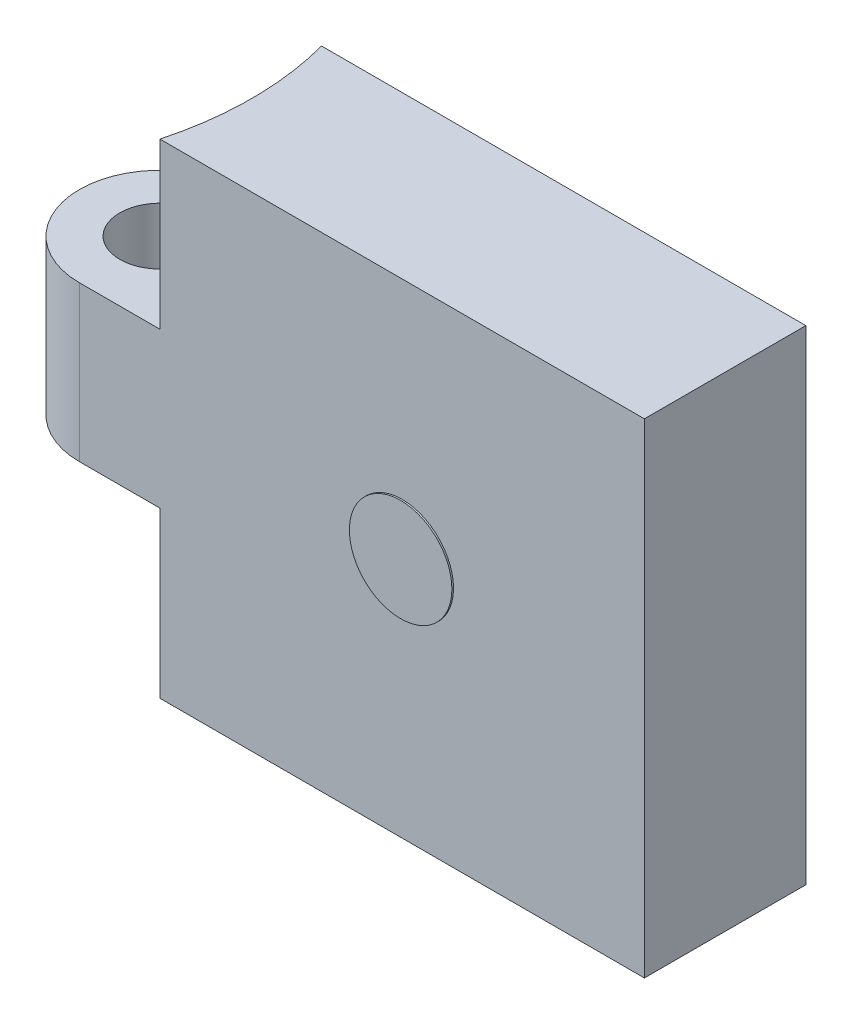
from build123d import *

# Parameters (mm, degrees)
RESSALTO_EXTRUS_O1_DEPTH = 10
ESBO_O2_R                = 2.5
CORTE_EXTRUS_O1_DEPTH    = 10
FILETE1_R                = 5
CORTE_EXTRUS_O4_DEPTH    = 10
CORTE_EXTRUS_O5_DEPTH    = 10
ESBO_O7_R                = 3.175
RESSALTO_EXTRUS_O2_DEPTH = 0.1


with BuildPart() as part:
    # Esboço1 → Ressalto-extrusão1 (new body)
    with BuildSketch(Plane.XY):
        Polygon((-10, -7.5), (20, 15), (-10, 15), (-10, 4.8), (-20, 4.8), (-20, -4.8), (-10, -4.8), align=None)
        Polygon((20, -15), (20, 15), (-10, -7.5), (-10, -15), align=None)
    extrude(amount=RESSALTO_EXTRUS_O1_DEPTH)

    # Esboço2 → Corte-extrusão1 (cut)
    with BuildSketch(Plane.XZ.offset(4.8)):
        with Locations(Location((-15, 5, 0), (0, 0, 270))):
            Circle(ESBO_O2_R)
    extrude(amount=-CORTE_EXTRUS_O1_DEPTH, mode=Mode.SUBTRACT)

    # Filete1
    filete1_edges = [part.edges().sort_by_distance(p)[0] for p in [
        (-20, 0, 0),
        (-20, 0, 10),
    ]]
    fillet(filete1_edges, radius=FILETE1_R - 0.0001)  # a hair under: the kernel refuses the full size

    # Esboço5 → Corte-extrusão4 (cut)
    with BuildSketch(Plane.XZ.offset(15)):
        with BuildLine():
            Line((-10, 10), (-10, 0))
            ThreePointArc((-10, 0), (-9.341737512, 5), (-10, 10))
        make_face()
    extrude(amount=-CORTE_EXTRUS_O4_DEPTH, mode=Mode.SUBTRACT)

    # Esboço6 → Corte-extrusão5 (cut)
    with BuildSketch(Plane(origin=(0, 15, 0), x_dir=(1, 0, 0), z_dir=(0, 1, 0))):
        with BuildLine():
            Line((-10, -9.950546275), (-10, 0))
            ThreePointArc((-10, 0), (-9.344992865, -4.975273137), (-10, -9.950546275))
        make_face()
    extrude(amount=-CORTE_EXTRUS_O5_DEPTH, mode=Mode.SUBTRACT)

    # Esboço7 → Ressalto-extrusão2 (add)
    with BuildSketch(Plane.XY.offset(10)):
        with Locations((5, 0)):
            Circle(ESBO_O7_R)
    extrude(amount=RESSALTO_EXTRUS_O2_DEPTH)


solid = part.part
